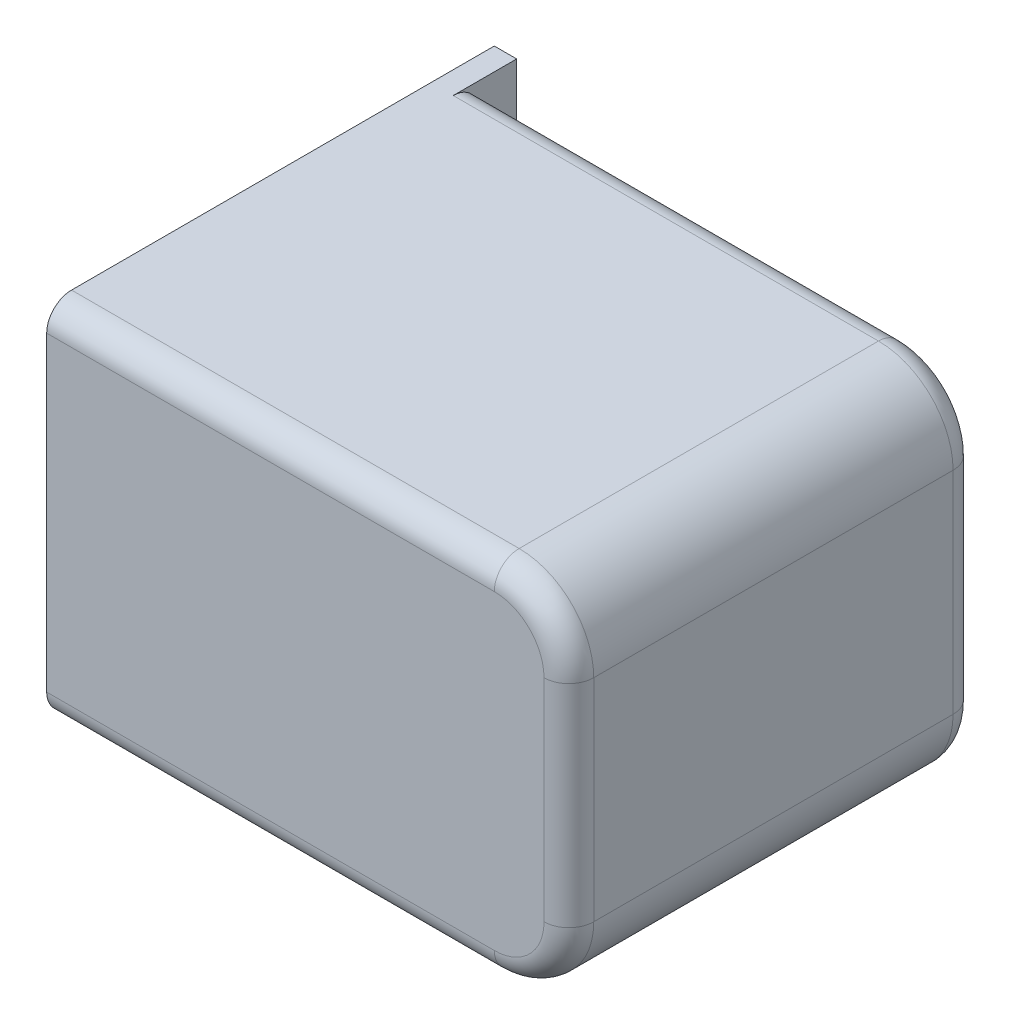
from build123d import *

# Parameters (mm, degrees)
SKETCH1_W                 = 210
SKETCH1_H                 = 145
BOSS_EXTRUDE1_DEPTH       = 180
SKETCH9_W                 = 201
SKETCH9_H                 = 145
CUT_EXTRUDE4_DEPTH        = 15.5
SKETCH2_R                 = 42.5
CUT_EXTRUDE1_DEPTH        = 25
SKETCH3_R                 = 52.5
CUT_EXTRUDE2_DEPTH        = 5.2
SKETCH4_R                 = 16
CUT_EXTRUDE3_DEPTH        = 5
FILLET1_R                 = 30
SHELL1_START              = 25.7
SHELL1_DEPTH              = 149.3
SHELL1_START_2            = 20.5
SHELL1_2_DEPTH            = 5.2
M6_TAPPED_HOLE1_D         = 5
M6_TAPPED_HOLE1_DEPTH     = 10
M6_TAPPED_HOLE1_TIP       = 1.502151548
F_6_0MM_DOWEL_HOLE1_D     = 6
F_6_0MM_DOWEL_HOLE1_DEPTH = 13
F_6_0MM_DOWEL_HOLE1_TIP   = 1.802581857
FILLET2_R                 = 10


# Read off the part's stored shape, not the designer's step: Shell1
with BuildPart() as part:
    # Sketch1 → Boss-Extrude1 (new body)
    with BuildSketch(Plane.XY):
        Rectangle(SKETCH1_W, SKETCH1_H)
    extrude(amount=BOSS_EXTRUDE1_DEPTH)

    # Sketch9 → Cut-Extrude4 (cut)
    with BuildSketch(Plane(origin=(0, 0, 0), x_dir=(-1, 0, 0), z_dir=(0, 0, -1))):
        with Locations((-4.5, 0)):
            Rectangle(SKETCH9_W, SKETCH9_H)
    extrude(amount=-CUT_EXTRUDE4_DEPTH, mode=Mode.SUBTRACT)

    # Sketch2 → Cut-Extrude1 (cut)
    with BuildSketch(Plane(origin=(0, 0, 0), x_dir=(-1, 0, 0), z_dir=(0, 0, -1))):
        with Locations((31.5, 12.85)):
            Circle(SKETCH2_R)
    extrude(amount=-CUT_EXTRUDE1_DEPTH, mode=Mode.SUBTRACT)

    # Sketch3 → Cut-Extrude2 (cut)
    with BuildSketch(Plane(origin=(0, 0, 15.5), x_dir=(-1, 0, 0), z_dir=(0, 0, -1))):
        with Locations((31.5, 12.85)):
            Circle(SKETCH3_R)
    extrude(amount=-CUT_EXTRUDE2_DEPTH, mode=Mode.SUBTRACT)

    # Sketch4 → Cut-Extrude3 (cut)
    with BuildSketch(Plane.ZY.offset(105)):
        with Locations((44.46, -15.32)):
            Circle(SKETCH4_R)
    extrude(amount=-CUT_EXTRUDE3_DEPTH, mode=Mode.SUBTRACT)

    # Fillet1
    fillet1_edges = [part.edges().sort_by_distance(p)[0] for p in [
        (105, -72.5, 97.75),
        (105, 72.5, 97.75),
    ]]
    fillet(fillet1_edges, radius=FILLET1_R)

    # Shell1 outline → Shell1 (cut)
    with BuildSketch(Plane.XY.offset(SHELL1_START)):
        with BuildLine():
            Line((-100, -67.5), (75, -67.5))
            ThreePointArc((75, -67.5), (92.67766953, -60.17766953), (100, -42.5))
            Line((100, -42.5), (100, 42.5))
            ThreePointArc((100, 42.5), (92.67766953, 60.17766953), (75, 67.5))
            Line((75, 67.5), (-100, 67.5))
            Line((-100, 67.5), (-100, -67.5))
        make_face()
    extrude(amount=SHELL1_DEPTH, mode=Mode.SUBTRACT)

    # Shell1 2 outline → Shell1 2 (cut)
    with BuildSketch(Plane.XY.offset(SHELL1_START_2)):
        with BuildLine():
            Line((-100, 67.5), (-100, -67.5))
            Line((-100, -67.5), (75, -67.5))
            ThreePointArc((75, -67.5), (92.67766953, -60.17766953), (100, -42.5))
            Line((100, -42.5), (100, 42.5))
            ThreePointArc((100, 42.5), (92.67766953, 60.17766953), (75, 67.5))
            Line((75, 67.5), (-13.621870903, 67.5))
            ThreePointArc((-13.621870903, 67.5), (-31.5, -44.65), (-49.378129097, 67.5))
            Line((-49.378129097, 67.5), (-100, 67.5))
        make_face()
    extrude(amount=SHELL1_2_DEPTH, mode=Mode.SUBTRACT)

    # M6 Tapped Hole1
    with Locations(Plane.ZY.offset(105)):
        with Locations((9.46, 41.83), (79.46, 41.83), (79.46, -53.42), (9.46, -53.42)):
            Hole(M6_TAPPED_HOLE1_D / 2, depth=M6_TAPPED_HOLE1_DEPTH)
            with Locations((0, 0, -(M6_TAPPED_HOLE1_DEPTH + M6_TAPPED_HOLE1_TIP / 2))):  # 118° drill point
                Cone(0, M6_TAPPED_HOLE1_D / 2, M6_TAPPED_HOLE1_TIP, mode=Mode.SUBTRACT)

    # Ø6.0mm Dowel Hole1
    with Locations(Plane.ZY.offset(105)):
        with Locations((44.46, 41.83), (44.46, -53.42)):
            Hole(F_6_0MM_DOWEL_HOLE1_D / 2, depth=F_6_0MM_DOWEL_HOLE1_DEPTH)
            with Locations((0, 0, -(F_6_0MM_DOWEL_HOLE1_DEPTH + F_6_0MM_DOWEL_HOLE1_TIP / 2))):  # 118° drill point
                Cone(0, F_6_0MM_DOWEL_HOLE1_D / 2, F_6_0MM_DOWEL_HOLE1_TIP, mode=Mode.SUBTRACT)

    # Fillet2
    # the kernel refuses this fillet: 10 mm, written as the material it takes off along each edge
    with BuildSketch(Plane(origin=(-130, -72.5, 180), x_dir=(0, 0, -1), z_dir=(1, 0, 0))) as fillet2_piece_1:
        with BuildLine():
            CenterArc((FILLET2_R, FILLET2_R), FILLET2_R, 180, 90)
            Line((0, FILLET2_R), (0, 0))
            Line((0, 0), (FILLET2_R, 0))
        make_face()
    extrude(amount=205, mode=Mode.SUBTRACT)
    with BuildSketch(Plane(origin=(75, 72.5, 15.5), x_dir=(0, -1, 0), z_dir=(-1, 0, 0))) as fillet2_piece_2:
        with BuildLine():
            CenterArc((FILLET2_R, FILLET2_R), FILLET2_R, 180, 90)
            Line((0, FILLET2_R), (0, 0))
            Line((0, 0), (FILLET2_R, 0))
        make_face()
    extrude(amount=171, mode=Mode.SUBTRACT)
    with BuildSketch(Plane(origin=(105, -42.5, 15.5), x_dir=(-1, 0, 0), z_dir=(0, 1, 0))) as fillet2_piece_3:
        with BuildLine():
            CenterArc((FILLET2_R, FILLET2_R), FILLET2_R, 180, 90)
            Line((0, FILLET2_R), (0, 0))
            Line((0, 0), (FILLET2_R, 0))
        make_face()
    extrude(amount=85, mode=Mode.SUBTRACT)
    with BuildSketch(Plane(origin=(105, -42.5, 180), x_dir=(-1, 0, 0), z_dir=(0, 1, 0))) as fillet2_piece_4:
        with BuildLine():
            CenterArc((FILLET2_R, -FILLET2_R), FILLET2_R, 90, 90)
            Line((0, -FILLET2_R), (0, 0))
            Line((0, 0), (FILLET2_R, 0))
        make_face()
    extrude(amount=85, mode=Mode.SUBTRACT)
    with BuildSketch(Plane(origin=(-96, -72.5, 15.5), x_dir=(0, 0, 1), z_dir=(1, 0, 0))) as fillet2_piece_5:
        with BuildLine():
            CenterArc((FILLET2_R, -FILLET2_R), FILLET2_R, 90, 90)
            Line((0, -FILLET2_R), (0, 0))
            Line((0, 0), (FILLET2_R, 0))
        make_face()
    extrude(amount=171, mode=Mode.SUBTRACT)
    with BuildSketch(Plane(origin=(75, 42.5, 15.5), x_dir=(1, 0, 0), z_dir=(0, -1, 0))) as fillet2_piece_6:
        with BuildLine():
            CenterArc((30 - FILLET2_R, FILLET2_R), FILLET2_R, 270, 90)
            Line((30, FILLET2_R), (30, 0))
            Line((30, 0), (30 - FILLET2_R, 0))
        make_face()
    revolve(axis=Axis((75, 42.5, 15.5), (0, 0, 1)), revolution_arc=90, mode=Mode.SUBTRACT)
    with BuildSketch(Plane(origin=(75, -42.5, 15.5), x_dir=(0, -1, 0), z_dir=(-1, 0, 0))) as fillet2_piece_7:
        with BuildLine():
            CenterArc((30 - FILLET2_R, FILLET2_R), FILLET2_R, 270, 90)
            Line((30, FILLET2_R), (30, 0))
            Line((30, 0), (30 - FILLET2_R, 0))
        make_face()
    revolve(axis=Axis((75, -42.5, 15.5), (0, 0, 1)), revolution_arc=90, mode=Mode.SUBTRACT)
    with BuildSketch(Plane(origin=(75, 72.5, 180), x_dir=(0, -1, 0), z_dir=(-1, 0, 0))) as fillet2_piece_8:
        with BuildLine():
            CenterArc((FILLET2_R, -FILLET2_R), FILLET2_R, 90, 90)
            Line((0, -FILLET2_R), (0, 0))
            Line((0, 0), (FILLET2_R, 0))
        make_face()
    extrude(amount=205, mode=Mode.SUBTRACT)
    with BuildSketch(Plane(origin=(75, 42.5, 180), x_dir=(1, 0, 0), z_dir=(0, -1, 0))) as fillet2_piece_9:
        with BuildLine():
            CenterArc((30 - FILLET2_R, -FILLET2_R), FILLET2_R, 0, 90)
            Line((30, -FILLET2_R), (30, 0))
            Line((30, 0), (30 - FILLET2_R, 0))
        make_face()
    revolve(axis=Axis((75, 42.5, 180), (0, 0, 1)), revolution_arc=90, mode=Mode.SUBTRACT)
    with BuildSketch(Plane(origin=(75, -42.5, 180), x_dir=(0, -1, 0), z_dir=(-1, 0, 0))) as fillet2_piece_10:
        with BuildLine():
            CenterArc((30 - FILLET2_R, -FILLET2_R), FILLET2_R, 0, 90)
            Line((30 - FILLET2_R, 0), (30, 0))
            Line((30, 0), (30, -FILLET2_R))
        make_face()
    revolve(axis=Axis((75, -42.5, 180), (0, 0, 1)), revolution_arc=90, mode=Mode.SUBTRACT)


solid = part.part
